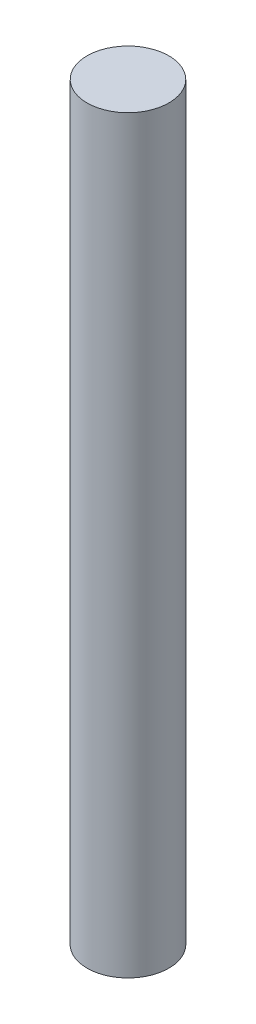
from build123d import *

# Parameters (mm, degrees)
SKETCH2_R           = 3
BOSS_EXTRUDE1_DEPTH = 55


with BuildPart() as part:
    # Sketch2 → Boss-Extrude1 (new body)
    with BuildSketch(Plane(origin=(0, 0, 0), x_dir=(1, 0, 0), z_dir=(0, 1, 0))):
        Circle(SKETCH2_R)
    extrude(amount=BOSS_EXTRUDE1_DEPTH)


solid = part.part
